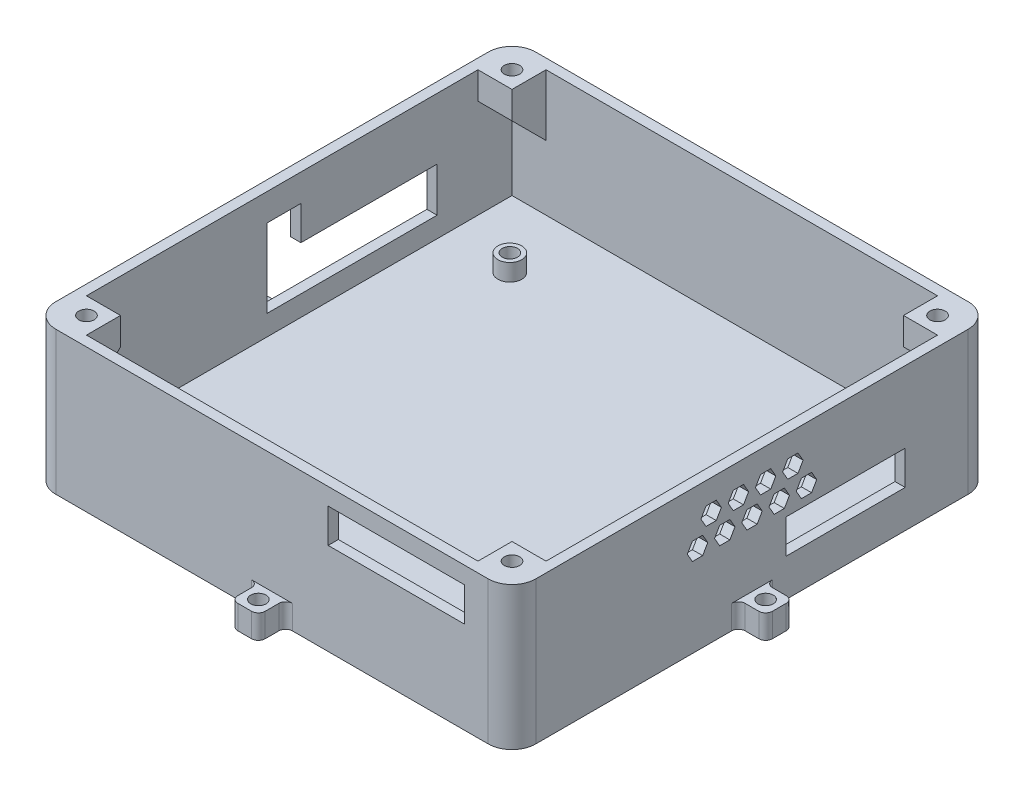
from build123d import *

# Parameters (mm, degrees)
SKETCH1_W                 = 135
SKETCH1_H                 = 135
SKETCH1_R                 = 2.25
BOSS_EXTRUDE1_DEPTH       = 5
SKETCH2_R                 = 3.5
SKETCH2_R_2               = 2.25
BOSS_EXTRUDE2_DEPTH       = 5
MIRROR2_COPY_1_SKETCH_R   = 3.5
MIRROR2_COPY_1_SKETCH_R_2 = 2.25
MIRROR2_COPY_1_DEPTH      = 5
SKETCH4_W                 = 141
SKETCH4_H                 = 141
SKETCH4_W_2               = 135
SKETCH4_H_2               = 135
BOSS_EXTRUDE3_DEPTH       = 42
CUT_EXTRUDE2_REACH        = 165.142
CUT_EXTRUDE3_REACH        = 165.142
SKETCH7_W                 = 40
SKETCH7_H                 = 10
CUT_EXTRUDE4_REACH        = 165.142
SKETCH9_W                 = 10
SKETCH9_H                 = 10
SKETCH9_R                 = 2.25
BOSS_EXTRUDE4_DEPTH       = 8
CHAMFER2_SIZE             = 10
SKETCH10_W                = 8
SKETCH10_H                = 7
BOSS_EXTRUDE5_DEPTH       = 8
SKETCH11_R                = 2.25
CUT_EXTRUDE5_DEPTH        = 112.164292828
CIRPATTERN1_COUNT         = 4
FILLET1_R                 = 2
CUT_EXTRUDE6_REACH        = 175.572
SKETCH12_W                = 35
SKETCH12_H                = 10
FILLET2_R                 = 7


with BuildPart() as part:
    # Sketch1 → Boss-Extrude1 (new body)
    with BuildSketch(Plane(origin=(0, 0, 0), x_dir=(1, 0, 0), z_dir=(0, 1, 0))):
        Rectangle(SKETCH1_W, SKETCH1_H)
        with Locations(Location((-48.26, 47.625, 0), (0, 0, 270))):
            Circle(SKETCH1_R, mode=Mode.SUBTRACT)
        with Locations(Location((48.26, 47.625, 0), (0, 0, 270))):
            Circle(SKETCH1_R, mode=Mode.SUBTRACT)
        with Locations(Location((48.26, -47.625, 0), (0, 0, 270))):
            Circle(SKETCH1_R, mode=Mode.SUBTRACT)
        with Locations(Location((-48.26, -47.625, 0), (0, 0, 270))):
            Circle(SKETCH1_R, mode=Mode.SUBTRACT)
    extrude(amount=BOSS_EXTRUDE1_DEPTH)

    # Sketch2 → Boss-Extrude2 (add)
    with BuildSketch(Plane(origin=(0, 5, 0), x_dir=(1, 0, 0), z_dir=(0, 1, 0))):
        with Locations(Location((-48.26, 47.625, 0), (0, 0, 270))):
            Circle(SKETCH2_R)
        with Locations(Location((-48.26, 47.625, 0), (0, 0, 270))):
            Circle(SKETCH2_R_2, mode=Mode.SUBTRACT)
    boss_extrude2 = extrude(amount=BOSS_EXTRUDE2_DEPTH)

    # Mirror1: Boss-Extrude2 across plane
    add(boss_extrude2.mirror(Plane.XY))

    # Mirror2: Boss-Extrude2 across plane
    add(boss_extrude2.mirror(Plane(origin=(0, 0, 0), x_dir=(0, 0, 1), z_dir=(1, 0, 0))))

    # Mirror2 copy 1 sketch → Mirror2 copy 1 (add)
    with BuildSketch(Plane(origin=(0, 5, 0), x_dir=(-1, 0, 0), z_dir=(0, 1, 0))):
        with Locations(Location((-48.26, 47.625, 0), (0, 0, 270))):
            Circle(MIRROR2_COPY_1_SKETCH_R)
        with Locations(Location((-48.26, 47.625, 0), (0, 0, 270))):
            Circle(MIRROR2_COPY_1_SKETCH_R_2, mode=Mode.SUBTRACT)
    extrude(amount=MIRROR2_COPY_1_DEPTH)

    # Sketch4 → Boss-Extrude3 (add)
    with BuildSketch(Plane(origin=(0, 0, 0), x_dir=(1, 0, 0), z_dir=(0, 1, 0))):
        Rectangle(SKETCH4_W, SKETCH4_H)
        Rectangle(SKETCH4_W_2, SKETCH4_H_2, mode=Mode.SUBTRACT)
    extrude(amount=BOSS_EXTRUDE3_DEPTH)

    # Sketch6 → Cut-Extrude2 (cut, up to next)
    with BuildSketch(Plane.ZY.offset(70.5), mode=Mode.PRIVATE) as cut_extrude2_sk1:
        Polygon((-45.5, 24), (-5.5, 24), (-5.5, 34), (4.5, 34), (4.5, 24), (4.5, 11), (-45.5, 11), align=None)
    cut_extrude2_tool1 = extrude(cut_extrude2_sk1.sketch, amount=-CUT_EXTRUDE2_REACH, mode=Mode.PRIVATE) & part.part
    add(cut_extrude2_tool1.solids().sort_by_distance((-70.5, 19.033333, -17.833333))[0], mode=Mode.SUBTRACT)

    # Sketch7 → Cut-Extrude3 (cut, up to next)
    with BuildSketch(Plane.XY.offset(70.5), mode=Mode.PRIVATE) as cut_extrude3_sk1:
        with Locations((36.5, 32)):
            Rectangle(SKETCH7_W, SKETCH7_H)
    cut_extrude3_tool1 = extrude(cut_extrude3_sk1.sketch, amount=-CUT_EXTRUDE3_REACH, mode=Mode.PRIVATE) & part.part
    add(cut_extrude3_tool1.solids().sort_by_distance((36.5, 32, 70.5))[0], mode=Mode.SUBTRACT)

    # Sketch8 → Cut-Extrude4 (cut, up to next)
    with BuildSketch(Plane(origin=(70.5, 0, 0), x_dir=(0, 0, -1), z_dir=(1, 0, 0)), mode=Mode.PRIVATE) as cut_extrude4_sk1:
        Polygon((-13, 26), (-14.5, 28.598076211), (-17.5, 28.598076211), (-19, 26), (-17.5, 23.401923789), (-14.5, 23.401923789), align=None)
    cut_extrude4_tool1 = extrude(cut_extrude4_sk1.sketch, amount=-CUT_EXTRUDE4_REACH, mode=Mode.PRIVATE) & part.part
    # Sketch8 → Cut-Extrude4 (cut, up to next)
    with BuildSketch(Plane(origin=(70.5, 0, 0), x_dir=(0, 0, -1), z_dir=(1, 0, 0)), mode=Mode.PRIVATE) as cut_extrude4_sk2:
        Polygon((-9.5, 28.598076211), (-11, 26), (-9.5, 23.401923789), (-6.5, 23.401923789), (-5, 26), (-6.5, 28.598076211), align=None)
    cut_extrude4_tool2 = extrude(cut_extrude4_sk2.sketch, amount=-CUT_EXTRUDE4_REACH, mode=Mode.PRIVATE) & part.part
    # Sketch8 → Cut-Extrude4 (cut, up to next)
    with BuildSketch(Plane(origin=(70.5, 0, 0), x_dir=(0, 0, -1), z_dir=(1, 0, 0)), mode=Mode.PRIVATE) as cut_extrude4_sk3:
        Polygon((-1.5, 28.598076211), (-3, 26), (-1.5, 23.401923789), (1.5, 23.401923789), (3, 26), (1.5, 28.598076211), align=None)
    cut_extrude4_tool3 = extrude(cut_extrude4_sk3.sketch, amount=-CUT_EXTRUDE4_REACH, mode=Mode.PRIVATE) & part.part
    # Sketch8 → Cut-Extrude4 (cut, up to next)
    with BuildSketch(Plane(origin=(70.5, 0, 0), x_dir=(0, 0, -1), z_dir=(1, 0, 0)), mode=Mode.PRIVATE) as cut_extrude4_sk4:
        Polygon((6.5, 28.598076211), (5, 26), (6.5, 23.401923789), (9.5, 23.401923789), (11, 26), (9.5, 28.598076211), align=None)
    cut_extrude4_tool4 = extrude(cut_extrude4_sk4.sketch, amount=-CUT_EXTRUDE4_REACH, mode=Mode.PRIVATE) & part.part
    # Sketch8 → Cut-Extrude4 (cut, up to next)
    with BuildSketch(Plane(origin=(70.5, 0, 0), x_dir=(0, 0, -1), z_dir=(1, 0, 0)), mode=Mode.PRIVATE) as cut_extrude4_sk5:
        Polygon((14.5, 28.598076211), (13, 26), (14.5, 23.401923789), (17.5, 23.401923789), (19, 26), (17.5, 28.598076211), align=None)
    cut_extrude4_tool5 = extrude(cut_extrude4_sk5.sketch, amount=-CUT_EXTRUDE4_REACH, mode=Mode.PRIVATE) & part.part
    # Sketch8 → Cut-Extrude4 (cut, up to next)
    with BuildSketch(Plane(origin=(70.5, 0, 0), x_dir=(0, 0, -1), z_dir=(1, 0, 0)), mode=Mode.PRIVATE) as cut_extrude4_sk6:
        Polygon((-5.5, 35.526279442), (-7, 32.92820323), (-5.5, 30.330127019), (-2.5, 30.330127019), (-1, 32.92820323), (-2.5, 35.526279442), align=None)
    cut_extrude4_tool6 = extrude(cut_extrude4_sk6.sketch, amount=-CUT_EXTRUDE4_REACH, mode=Mode.PRIVATE) & part.part
    # Sketch8 → Cut-Extrude4 (cut, up to next)
    with BuildSketch(Plane(origin=(70.5, 0, 0), x_dir=(0, 0, -1), z_dir=(1, 0, 0)), mode=Mode.PRIVATE) as cut_extrude4_sk7:
        Polygon((2.5, 35.526279442), (1, 32.92820323), (2.5, 30.330127019), (5.5, 30.330127019), (7, 32.92820323), (5.5, 35.526279442), align=None)
    cut_extrude4_tool7 = extrude(cut_extrude4_sk7.sketch, amount=-CUT_EXTRUDE4_REACH, mode=Mode.PRIVATE) & part.part
    # Sketch8 → Cut-Extrude4 (cut, up to next)
    with BuildSketch(Plane(origin=(70.5, 0, 0), x_dir=(0, 0, -1), z_dir=(1, 0, 0)), mode=Mode.PRIVATE) as cut_extrude4_sk8:
        Polygon((10.5, 35.526279442), (9, 32.92820323), (10.5, 30.330127019), (13.5, 30.330127019), (15, 32.92820323), (13.5, 35.526279442), align=None)
    cut_extrude4_tool8 = extrude(cut_extrude4_sk8.sketch, amount=-CUT_EXTRUDE4_REACH, mode=Mode.PRIVATE) & part.part
    # Sketch8 → Cut-Extrude4 (cut, up to next)
    with BuildSketch(Plane(origin=(70.5, 0, 0), x_dir=(0, 0, -1), z_dir=(1, 0, 0)), mode=Mode.PRIVATE) as cut_extrude4_sk9:
        Polygon((-13.5, 35.526279442), (-15, 32.92820323), (-13.5, 30.330127019), (-10.5, 30.330127019), (-9, 32.92820323), (-10.5, 35.526279442), align=None)
    cut_extrude4_tool9 = extrude(cut_extrude4_sk9.sketch, amount=-CUT_EXTRUDE4_REACH, mode=Mode.PRIVATE) & part.part
    add(cut_extrude4_tool1.solids().sort_by_distance((70.5, 26, 16))[0], mode=Mode.SUBTRACT)
    add(cut_extrude4_tool2.solids().sort_by_distance((70.5, 26, 8))[0], mode=Mode.SUBTRACT)
    add(cut_extrude4_tool3.solids().sort_by_distance((70.5, 26, 0))[0], mode=Mode.SUBTRACT)
    add(cut_extrude4_tool4.solids().sort_by_distance((70.5, 26, -8))[0], mode=Mode.SUBTRACT)
    add(cut_extrude4_tool5.solids().sort_by_distance((70.5, 26, -16))[0], mode=Mode.SUBTRACT)
    add(cut_extrude4_tool6.solids().sort_by_distance((70.5, 32.928203, 4))[0], mode=Mode.SUBTRACT)
    add(cut_extrude4_tool7.solids().sort_by_distance((70.5, 32.928203, -4))[0], mode=Mode.SUBTRACT)
    add(cut_extrude4_tool8.solids().sort_by_distance((70.5, 32.928203, -12))[0], mode=Mode.SUBTRACT)
    add(cut_extrude4_tool9.solids().sort_by_distance((70.5, 32.928203, 12))[0], mode=Mode.SUBTRACT)

    # Sketch9 → Boss-Extrude4 (add)
    # profile 1 of 4: a face of its own
    with BuildSketch(Plane(origin=(0, 42, 0), x_dir=(1, 0, 0), z_dir=(0, 1, 0))):
        with Locations((-62.5, 62.5)):
            Rectangle(SKETCH9_W, SKETCH9_H)
        with Locations(Location((-62.5, 62.5, 0), (0, 0, 270))):
            Circle(SKETCH9_R, mode=Mode.SUBTRACT)
    # profile 2 of 4: a face of its own
    with BuildSketch(Plane(origin=(0, 42, 0), x_dir=(1, 0, 0), z_dir=(0, 1, 0))):
        with Locations((-62.5, -62.5)):
            Rectangle(SKETCH9_W, SKETCH9_H)
        with Locations(Location((-62.5, -62.5, 0), (0, 0, 90))):
            Circle(SKETCH9_R, mode=Mode.SUBTRACT)
    # profile 3 of 4: a face of its own
    with BuildSketch(Plane(origin=(0, 42, 0), x_dir=(1, 0, 0), z_dir=(0, 1, 0))):
        with Locations((62.5, 62.5)):
            Rectangle(SKETCH9_W, SKETCH9_H)
        with Locations(Location((62.5, 62.5, 0), (0, 0, 90))):
            Circle(SKETCH9_R, mode=Mode.SUBTRACT)
    # profile 4 of 4: a face of its own
    with BuildSketch(Plane(origin=(0, 42, 0), x_dir=(1, 0, 0), z_dir=(0, 1, 0))):
        with Locations((62.5, -62.5)):
            Rectangle(SKETCH9_W, SKETCH9_H)
        with Locations(Location((62.5, -62.5, 0), (0, 0, 270))):
            Circle(SKETCH9_R, mode=Mode.SUBTRACT)
    extrude(amount=-BOSS_EXTRUDE4_DEPTH)

    # Chamfer2
    # the kernel refuses this chamfer: 10 mm, written as the material it adds along each edge
    with BuildSketch(Plane(origin=(-67.5, 34, -67.5), x_dir=(0, -0.9996219169112968, -0.027495876610586317), z_dir=(1, 0, 0))) as chamfer2_piece_1_section:
        Polygon((CHAMFER2_SIZE * 0.999621916911, -CHAMFER2_SIZE * 0.0274958766106), (-CHAMFER2_SIZE * 0.0274958766106, -CHAMFER2_SIZE * 0.999621916911), (0, 0), align=None)
    chamfer2_piece_1 = extrude(amount=10, mode=Mode.PRIVATE)
    chamfer2_piece_1 = chamfer2_piece_1 - Plane(origin=(-62.5, 25.719641091, -62.5), x_dir=(0, 0, 1), z_dir=(0, 1, 0)) * Cylinder(2.25, 60, mode=Mode.PRIVATE)
    add(chamfer2_piece_1)
    with BuildSketch(Plane(origin=(-67.5, 34, 67.5), x_dir=(0, -0.9996219169112968, 0.02749587661058908), z_dir=(1, 0, 0))) as chamfer2_piece_2_section:
        Polygon((CHAMFER2_SIZE * 0.999621916911, CHAMFER2_SIZE * 0.0274958766106), (-CHAMFER2_SIZE * 0.0274958766106, CHAMFER2_SIZE * 0.999621916911), (0, 0), align=None)
    chamfer2_piece_2 = extrude(amount=10, mode=Mode.PRIVATE)
    chamfer2_piece_2 = chamfer2_piece_2 - Plane(origin=(-62.5, 25.719641091, 62.5), x_dir=(0, 0, -1), z_dir=(0, 1, 0)) * Cylinder(2.25, 60, mode=Mode.PRIVATE)
    add(chamfer2_piece_2)
    with BuildSketch(Plane(origin=(57.5, 34, 67.5), x_dir=(0, -0.9996219169112968, 0.0274958766105877), z_dir=(1, 0, 0))) as chamfer2_piece_3_section:
        Polygon((CHAMFER2_SIZE * 0.999621916911, CHAMFER2_SIZE * 0.0274958766106), (-CHAMFER2_SIZE * 0.0274958766106, CHAMFER2_SIZE * 0.999621916911), (0, 0), align=None)
    chamfer2_piece_3 = extrude(amount=10, mode=Mode.PRIVATE)
    chamfer2_piece_3 = chamfer2_piece_3 - Plane(origin=(62.5, 25.999278789, 62.5), x_dir=(0, 0, 1), z_dir=(0, 1, 0)) * Cylinder(2.25, 60, mode=Mode.PRIVATE)
    add(chamfer2_piece_3)
    with BuildSketch(Plane(origin=(67.5, 34, -67.5), x_dir=(0, -0.9996219169112968, -0.0274958766105877), z_dir=(-1, 0, 0))) as chamfer2_piece_4_section:
        Polygon((CHAMFER2_SIZE * 0.999621916911, CHAMFER2_SIZE * 0.0274958766106), (-CHAMFER2_SIZE * 0.0274958766106, CHAMFER2_SIZE * 0.999621916911), (0, 0), align=None)
    chamfer2_piece_4 = extrude(amount=10, mode=Mode.PRIVATE)
    chamfer2_piece_4 = chamfer2_piece_4 - Plane(origin=(62.5, 25.719641091, -62.5), x_dir=(0, 0, -1), z_dir=(0, 1, 0)) * Cylinder(2.25, 60, mode=Mode.PRIVATE)
    add(chamfer2_piece_4)

    # Sketch10 → Boss-Extrude5 (add)
    with BuildSketch(Plane.XY.offset(70.5)):
        with Locations((0, 3.5)):
            Rectangle(SKETCH10_W, SKETCH10_H)
    boss_extrude5 = extrude(amount=BOSS_EXTRUDE5_DEPTH)

    # Sketch11 → Cut-Extrude5 (cut, through all)
    with BuildSketch(Plane(origin=(0, 7, 0), x_dir=(1, 0, 0), z_dir=(0, 1, 0))):
        with Locations(Location((0, -74.5, 0), (0, 0, 270))):
            Circle(SKETCH11_R)
    cut_extrude5 = extrude(amount=-CUT_EXTRUDE5_DEPTH, mode=Mode.SUBTRACT)

    # CirPattern1: Boss-Extrude5, Cut-Extrude5 ×4 about axis
    cirpattern1_axis = Axis((0, 0, 0), (0, 1, 0))
    add([boss_extrude5.rotate(cirpattern1_axis, i * 360 / CIRPATTERN1_COUNT) for i in range(1, CIRPATTERN1_COUNT)])
    add([cut_extrude5.rotate(cirpattern1_axis, i * 360 / CIRPATTERN1_COUNT) for i in range(1, CIRPATTERN1_COUNT)], mode=Mode.SUBTRACT)

    # Fillet1
    fillet1_edges = [part.edges().sort_by_distance(p)[0] for p in [
        (-4, 3.5, 70.5),
        (4, 3.5, 70.5),
        (-4, 3.5, 78.5),
        (4, 3.5, 78.5),
        (70.5, 3.5, 4),
        (70.5, 3.5, -4),
        (78.5, 3.5, 4),
        (78.5, 3.5, -4),
        (4, 3.5, -70.5),
        (-4, 3.5, -70.5),
        (4, 3.5, -78.5),
        (-4, 3.5, -78.5),
        (-70.5, 3.5, -4),
        (-70.5, 3.5, 4),
        (-78.5, 3.5, -4),
        (-78.5, 3.5, 4),
    ]]
    fillet(fillet1_edges, radius=FILLET1_R)

    # Sketch12 → Cut-Extrude6 (cut, up to next)
    with BuildSketch(Plane(origin=(70.5, 0, 0), x_dir=(0, 0, -1), z_dir=(1, 0, 0)), mode=Mode.PRIVATE) as cut_extrude6_sk1:
        with Locations((27.5, 16)):
            Rectangle(SKETCH12_W, SKETCH12_H)
    cut_extrude6_tool1 = extrude(cut_extrude6_sk1.sketch, amount=-CUT_EXTRUDE6_REACH, mode=Mode.PRIVATE) & part.part
    add(cut_extrude6_tool1.solids().sort_by_distance((70.5, 16, -27.5))[0], mode=Mode.SUBTRACT)

    # Fillet2
    fillet2_edges = [part.edges().sort_by_distance(p)[0] for p in [
        (70.5, 21, 70.5),
        (70.5, 21, -70.5),
        (-70.5, 21, -70.5),
        (-70.5, 21, 70.5),
    ]]
    fillet(fillet2_edges, radius=FILLET2_R)


solid = part.part
